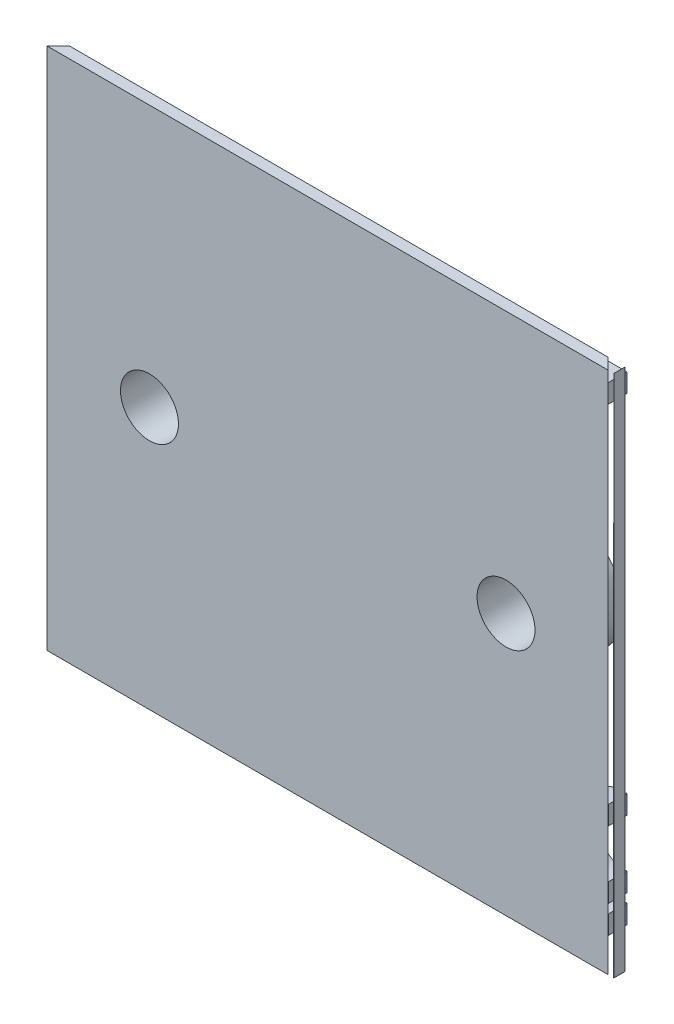
from build123d import *
from build123d.topology import SkipClean

# Parameters (mm, degrees)
SKETCH_3_R          = 2.6
EXTRUDE_1_DEPTH     = 1.2
EXTRUDE_1_2_DEPTH   = 2
CUT_EXTRUDE_2_DEPTH = 2
SKETCH_7_W          = 61.190195572
SKETCH_7_H          = 47.2
CUT_EXTRUDE_1_DEPTH = 2
EXTRUDE_START       = 5.4
SKETCH_8_R          = 6
SKETCH_8_R_2        = 2.6
EXTRUDE_2_DEPTH     = 5.4
SKETCH_9_R          = 3
SKETCH_9_R_2        = 2
EXTRUDE_2_2_DEPTH   = 2
SKETCH_10_R         = 4.6
SKETCH_10_R_2       = 2
EXTRUDE_3_DEPTH     = 2
CUT_EXTRUDE_START   = -2
SKETCH_11_R         = 2.6
SKETCH_11_R_2       = 2
CUT_EXTRUDE_3_DEPTH = 2
CUT_EXTRUDE_4_DEPTH = 62
SKETCH_13_W         = 4.275106326
SKETCH_13_H         = 2
SKETCH_13_W_2       = 4.284804349
CUT_EXTRUDE_5_DEPTH = 62
SKETCH_14_W         = 30.93798866
SKETCH_14_H         = 51.210222553
CUT_EXTRUDE_6_DEPTH = 5.4
SKETCH_17_R         = 3.1
CUT_EXTRUDE_8_DEPTH = 4.6
CHAMFER_1_SIZE      = 1.1


with BuildPart() as part:
    # Эскиз3 → Extrude 1 (new body)
    with BuildSketch(Plane.XY):
        Polygon((30.6, -28.01415885), (30.6, 27.98584115), (-30.607237283, 28.01415885), (-30.588738779, -27.985838095), align=None)
        with Locations((-19.06798866, 0.017969087)):
            Circle(SKETCH_3_R, mode=Mode.SUBTRACT)
        with Locations((19.07, -0.01415885)):
            Circle(SKETCH_3_R, mode=Mode.SUBTRACT)
    extrude(amount=EXTRUDE_1_DEPTH)

    # Эскиз5 → Extrude 1 2 (add)
    with BuildSketch(Plane(origin=(0, 0, 0), x_dir=(-1, 0, 0), z_dir=(0, 0, -1))):
        Polygon((-30.6, 26.034377354), (30.606576622, 26.014158959), (30.58939944, -25.985838204), (-30.6, -25.965625483), align=None)
        Polygon((-28.2, 23.63358443), (28.20578396, 23.614951883), (28.190192364, -23.585045542), (-28.2, -23.566418145), align=None, mode=Mode.SUBTRACT)
    extrude(amount=EXTRUDE_1_2_DEPTH)

    # Эскиз6 → Вырез-Вытянуть-Тонкостенный2 (cut)
    with BuildSketch(Plane(origin=(0, 0, -2), x_dir=(-1, 0, 0), z_dir=(0, 0, -1))):
        Polygon((-30.6, 26.034377354), (-30.6, -25.965625483), (30.58939944, -25.985838204), (30.606576622, 26.014158959), align=None)
        Polygon((-30.2, 25.6342452), (-30.2, -25.565757593), (30.189531594, -25.585706094), (30.206444512, 25.614291113), align=None, mode=Mode.SUBTRACT)
    extrude(amount=-CUT_EXTRUDE_2_DEPTH, mode=Mode.SUBTRACT)

    # Эскиз7 → Вырез-Вытянуть1 (cut)
    with BuildSketch(Plane(origin=(0, 0, -2), x_dir=(-1, 0, 0), z_dir=(0, 0, -1))):
        with Locations((-0.004902214, 0.024268156)):
            Rectangle(SKETCH_7_W, SKETCH_7_H)
    extrude(amount=-CUT_EXTRUDE_1_DEPTH, mode=Mode.SUBTRACT)

    # Эскиз8 → Extrude 2 (add)
    # profile 1 of 2: a face of its own
    with SkipClean():  # the faces are left unmerged after this step: merging them gives an invalid solid
        with BuildSketch(Plane(origin=(0, 0, 0), x_dir=(-1, 0, 0), z_dir=(0, 0, -1)).offset(EXTRUDE_START)):
            with Locations(Location((-19.07, -0.01415885, 0), (0, 0, 180))):
                Circle(SKETCH_8_R)
            with Locations((-19.07, -0.01415885)):
                Circle(SKETCH_8_R_2, mode=Mode.SUBTRACT)
        # profile 2 of 2: a face of its own
        with BuildSketch(Plane(origin=(0, 0, 0), x_dir=(-1, 0, 0), z_dir=(0, 0, -1)).offset(EXTRUDE_START)):
            with Locations(Location((19.06798866, 0.017969087, 0), (0, 0, 180))):
                Circle(SKETCH_8_R)
            with Locations((19.06798866, 0.017969087)):
                Circle(SKETCH_8_R_2, mode=Mode.SUBTRACT)
        extrude(amount=-EXTRUDE_2_DEPTH)

    # Эскиз9 → Extrude 2 2 (add)
    # profile 1 of 2: a face of its own
    with SkipClean():  # the faces are left unmerged after this step: merging them gives an invalid solid
        with BuildSketch(Plane(origin=(0, 0, -5.4), x_dir=(-1, 0, 0), z_dir=(0, 0, -1))):
            with Locations((-19.07, -0.01415885)):
                Circle(SKETCH_9_R)
            with Locations((-19.07, -0.01415885)):
                Circle(SKETCH_9_R_2, mode=Mode.SUBTRACT)
        # profile 2 of 2: a face of its own
        with BuildSketch(Plane(origin=(0, 0, -5.4), x_dir=(-1, 0, 0), z_dir=(0, 0, -1))):
            with Locations((19.06798866, 0.017969087)):
                Circle(SKETCH_9_R)
            with Locations((19.06798866, 0.017969087)):
                Circle(SKETCH_9_R_2, mode=Mode.SUBTRACT)
        extrude(amount=-EXTRUDE_2_2_DEPTH)

    # Эскиз10 → Вытянуть-Тонкостенный3 (add)
    # profile 1 of 2: a face of its own
    with SkipClean():  # the faces are left unmerged after this step: merging them gives an invalid solid
        with BuildSketch(Plane(origin=(0, 0, 0), x_dir=(-1, 0, 0), z_dir=(0, 0, -1))):
            with Locations((28.5, -18.01415885)):
                Circle(SKETCH_10_R)
            with Locations((28.5, -18.01415885)):
                Circle(SKETCH_10_R_2, mode=Mode.SUBTRACT)
        # profile 2 of 2: a face of its own
        with BuildSketch(Plane(origin=(0, 0, 0), x_dir=(-1, 0, 0), z_dir=(0, 0, -1))):
            with Locations((-28.5, -18.01415885)):
                Circle(SKETCH_10_R)
            with Locations((-28.5, -18.01415885)):
                Circle(SKETCH_10_R_2, mode=Mode.SUBTRACT)
        extrude(amount=EXTRUDE_3_DEPTH)

    # Эскиз11 → Вырез-Вытянуть-Тонкостенный3 (cut)
    # profile 1 of 2: a face of its own
    with SkipClean():  # the faces are left unmerged after this step: merging them gives an invalid solid
        with BuildSketch(Plane(origin=(0, 0, -2), x_dir=(-1, 0, 0), z_dir=(0, 0, -1)).offset(CUT_EXTRUDE_START)):
            with Locations((28.5, -18.01415885)):
                Circle(SKETCH_11_R)
            with Locations((28.5, -18.01415885)):
                Circle(SKETCH_11_R_2, mode=Mode.SUBTRACT)
        # profile 2 of 2: a face of its own
        with BuildSketch(Plane(origin=(0, 0, -2), x_dir=(-1, 0, 0), z_dir=(0, 0, -1)).offset(CUT_EXTRUDE_START)):
            with Locations((-28.5, -18.01415885)):
                Circle(SKETCH_11_R)
            with Locations((-28.5, -18.01415885)):
                Circle(SKETCH_11_R_2, mode=Mode.SUBTRACT)
        extrude(amount=CUT_EXTRUDE_3_DEPTH, mode=Mode.SUBTRACT)

    # Эскиз12 → Вырез-Вытянуть4 (cut)
    with SkipClean():  # the faces are left unmerged after this step: merging them gives an invalid solid
        with BuildSketch(Plane(origin=(0.012954275, 27.999992332, 0), x_dir=(0.9999998929762139, -0.0004626527434190302, 0), z_dir=(0.0004626527434190302, 0.9999998929762139, 0))):
            Polygon((29.987048999, -1.2), (28.787048999, 0), (30.587048999, 0), (30.587048999, -1.2), align=None)
            Polygon((-30.020194835, -1.2), (-28.820194835, 0), (-30.620194835, 0), (-30.620194835, -1.2), align=None)
        extrude(amount=-CUT_EXTRUDE_4_DEPTH, mode=Mode.SUBTRACT)

    # Эскиз13 → Вырез-Вытянуть5 (cut)
    with SkipClean():  # the faces are left unmerged after this step: merging them gives an invalid solid
        with BuildSketch(Plane(origin=(-0.008464475, 25.624266425, 0), x_dir=(0.9999999454409052, 0.00033033042028954735, 0), z_dir=(-0.00033033042028954735, 0.9999999454409053, 0))):
            with Locations((-30.968395907, 1)):
                Rectangle(SKETCH_13_W, SKETCH_13_H)
            with Locations((30.951645646, 1)):
                Rectangle(SKETCH_13_W_2, SKETCH_13_H)
        extrude(amount=-CUT_EXTRUDE_5_DEPTH, mode=Mode.SUBTRACT)


with BuildPart() as cut_extrude_5_piece_1:
    # of the separate pieces the step leaves, piece 1, a body of its own (cut_extrude_5_pieces)
    add(part.part.solids().sort_by_distance((23.9, -18.01415885, 0))[0])

    # Эскиз14 → Вырез-Вытянуть6 (cut)
    with SkipClean():  # the faces are left unmerged after this step: merging them gives an invalid solid
        with BuildSketch(Plane(origin=(0, 0, -5.4), x_dir=(-1, 0, 0), z_dir=(0, 0, -1))):
            with Locations((-0.00100567, 0.024268156)):
                Rectangle(SKETCH_14_W, SKETCH_14_H)
        extrude(amount=-CUT_EXTRUDE_6_DEPTH, mode=Mode.SUBTRACT)

    # Эскиз17 → Вырез-Вытянуть8 (cut)
    with BuildSketch(Plane.XY.offset(1.2)):
        with Locations((-19.06798866, 0.017969087)):
            Circle(SKETCH_17_R)
        with Locations((19.07, -0.01415885)):
            Circle(SKETCH_17_R)
    extrude(amount=-CUT_EXTRUDE_8_DEPTH, mode=Mode.SUBTRACT)

    # Фаска1
    chamfer_1_edges = [cut_extrude_5_piece_1.edges().sort_by_distance(p)[0] for p in [
        (21.07, -0.01415885, -3.4),
        (-17.06798866, 0.017969087, -3.4),
    ]]
    chamfer(chamfer_1_edges, length=CHAMFER_1_SIZE - 0.0001)  # a hair under: the kernel refuses the full size


with BuildPart() as cut_extrude_5_piece_2:
    # of the separate pieces the step leaves, piece 2, a body of its own (cut_extrude_5_pieces)
    add(part.part.solids().sort_by_distance((30.6, -28.01415885, 0))[0])


solid = Compound([cut_extrude_5_piece_1.part, cut_extrude_5_piece_2.part])
